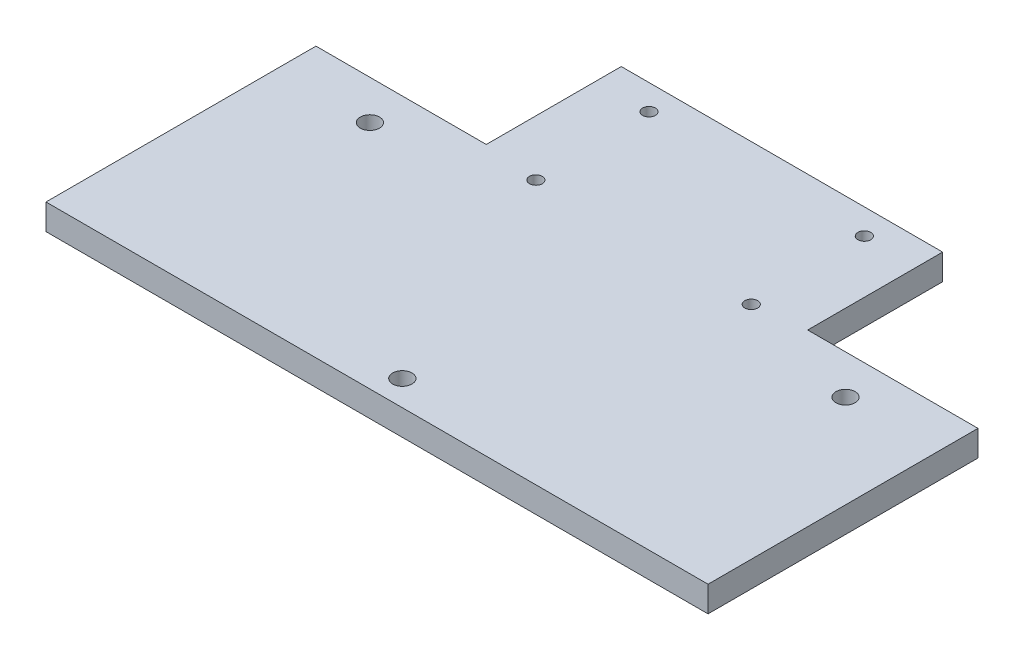
from build123d import *

# Parameters (mm, degrees)
SKETCH1_R           = 1.5
SKETCH1_R_2         = 1
BOSS_EXTRUDE1_DEPTH = 4


with BuildPart() as part:
    # Sketch1 → Boss-Extrude1 (new body)
    with BuildSketch(Plane(origin=(0, 0, 0), x_dir=(1, 0, 0), z_dir=(0, 1, 0))):
        Polygon((-47.617823434, 13.138325982), (-21.117823434, 13.138325982), (-21.117823434, 34.138325982), (28.882176566, 34.138325982), (28.882176566, 13.138325982), (55.382176566, 13.138325982), (55.382176566, -28.861674018), (-47.617823434, -28.861674018), align=None)
        with Locations((-33.117823434, 7.028381098)):
            Circle(SKETCH1_R, mode=Mode.SUBTRACT)
        with Locations((40.882176566, 7.028381098)):
            Circle(SKETCH1_R, mode=Mode.SUBTRACT)
        with Locations((3.882176566, -24.926770137)):
            Circle(SKETCH1_R, mode=Mode.SUBTRACT)
        with Locations((-12.867823434, 30.20271885)):
            Circle(SKETCH1_R_2, mode=Mode.SUBTRACT)
        with Locations((20.632176566, 30.20271885)):
            Circle(SKETCH1_R_2, mode=Mode.SUBTRACT)
        with Locations((-12.465097939, 12.207224631)):
            Circle(SKETCH1_R_2, mode=Mode.SUBTRACT)
        with Locations((21.034902061, 12.207224631)):
            Circle(SKETCH1_R_2, mode=Mode.SUBTRACT)
    extrude(amount=BOSS_EXTRUDE1_DEPTH)


solid = part.part
